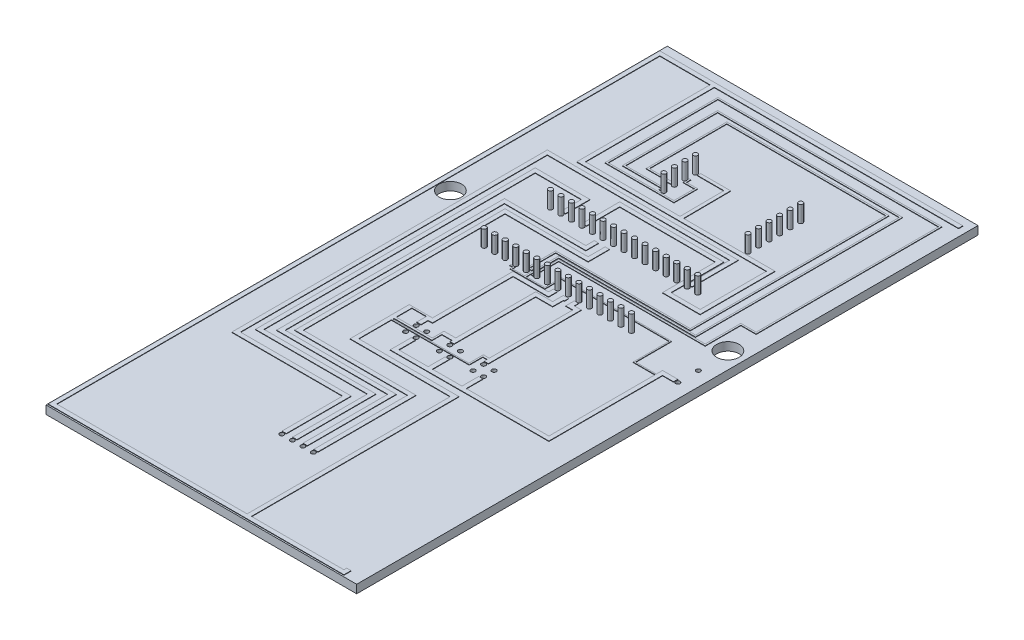
from build123d import *

# Parameters (mm, degrees)
SKETCH5_W           = 75
SKETCH5_H           = 150
BOSS_EXTRUDE1_DEPTH = 2
CUT_EXTRUDE2_START  = -2
SKETCH6_W           = 30
SKETCH6_H           = 30
CUT_EXTRUDE2_DEPTH  = 1.5
SKETCH7_R           = 0.53
BOSS_EXTRUDE2_DEPTH = 1.3
SKETCH8_R           = 0.52
CUT_EXTRUDE3_DEPTH  = 4
CUT_EXTRUDE4_DEPTH  = 4
SKETCH11_R          = 0.525
BOSS_EXTRUDE4_DEPTH = 4
SKETCH13_R          = 0.52
BOSS_EXTRUDE5_DEPTH = 4
CUT_EXTRUDE6_DEPTH  = 1
SKETCH17_R          = 0.52
SKETCH17_R_2        = 2.715
CUT_EXTRUDE8_DEPTH  = 84.94790051
BOSS_EXTRUDE6_DEPTH = 1.1


with BuildPart() as part:
    # Sketch5 → Boss-Extrude1 (new body)
    with BuildSketch(Plane(origin=(0, 0, 0), x_dir=(1, 0, 0), z_dir=(0, 1, 0))):
        Rectangle(SKETCH5_W, SKETCH5_H)
    extrude(amount=BOSS_EXTRUDE1_DEPTH)

    # Sketch6 → Cut-Extrude2 (cut)
    with BuildSketch(Plane(origin=(0, 2, 0), x_dir=(1, 0, 0), z_dir=(0, 1, 0)).offset(CUT_EXTRUDE2_START)):
        with Locations((0, -40)):
            Rectangle(SKETCH6_W, SKETCH6_H)
    extrude(amount=CUT_EXTRUDE2_DEPTH, mode=Mode.SUBTRACT)

    # Sketch7 → Boss-Extrude2 (add)
    with BuildSketch(Plane.XZ.offset(-1.5)):
        with Locations(Location((-2.92, 52.65, 0), (0, 0, 270))):
            Circle(SKETCH7_R)
        with Locations(Location((-0.38, 52.65, 0), (0, 0, 270))):
            Circle(SKETCH7_R)
        with Locations(Location((2.16, 52.65, 0), (0, 0, 270))):
            Circle(SKETCH7_R)
        with Locations(Location((4.7, 52.65, 0), (0, 0, 270))):
            Circle(SKETCH7_R)
    extrude(amount=BOSS_EXTRUDE2_DEPTH)

    # Sketch8 → Cut-Extrude3 (cut)
    with BuildSketch(Plane.XZ.offset(-0.2)):
        with Locations(Location((-2.92, 52.65, 0), (0, 0, 270))):
            Circle(SKETCH8_R)
        with Locations(Location((-0.38, 52.65, 0), (0, 0, 270))):
            Circle(SKETCH8_R)
        with Locations(Location((2.16, 52.65, 0), (0, 0, 270))):
            Circle(SKETCH8_R)
        with Locations(Location((4.7, 52.65, 0), (0, 0, 270))):
            Circle(SKETCH8_R)
    extrude(amount=-CUT_EXTRUDE3_DEPTH, mode=Mode.SUBTRACT)

    # Sketch9 → Cut-Extrude4 (cut)
    with BuildSketch(Plane.XZ):
        with BuildLine():
            ThreePointArc((-8.875, 16.27), (-9.779766594, 16.644766594), (-9.405, 15.74))
            Line((-9.405, 15.74), (-9.405, 16.27))
            Line((-9.405, 16.27), (-8.875, 16.27))
        make_face()
        with BuildLine():
            Line((-9.405, 16.27), (-9.405, 15.74))
            ThreePointArc((-9.405, 15.74), (-9.030233406, 15.895233406), (-8.875, 16.27))
            Line((-8.875, 16.27), (-9.405, 16.27))
        make_face()
        with BuildLine():
            ThreePointArc((-7.395, 16.27), (-7.239766594, 15.895233406), (-6.865, 15.74))
            Line((-6.865, 15.74), (-6.865, 16.27))
            Line((-6.865, 16.27), (-7.395, 16.27))
        make_face()
        with BuildLine():
            Line((-6.865, 16.27), (-6.865, 15.74))
            ThreePointArc((-6.865, 15.74), (-6.490233406, 15.895233406), (-6.335, 16.27))
            ThreePointArc((-6.335, 16.27), (-6.865, 16.8), (-7.395, 16.27))
            Line((-7.395, 16.27), (-6.865, 16.27))
        make_face()
        with BuildLine():
            ThreePointArc((-6.865, 14.26), (-7.239766594, 14.104766594), (-7.395, 13.73))
            Line((-7.395, 13.73), (-6.865, 13.73))
            Line((-6.865, 13.73), (-6.865, 14.26))
        make_face()
        with BuildLine():
            Line((-6.865, 13.73), (-7.395, 13.73))
            ThreePointArc((-7.395, 13.73), (-6.865, 13.2), (-6.335, 13.73))
            ThreePointArc((-6.335, 13.73), (-6.490233406, 14.104766594), (-6.865, 14.26))
            Line((-6.865, 14.26), (-6.865, 13.73))
        make_face()
        with BuildLine():
            Line((-9.405, 14.26), (-9.405, 13.73))
            Line((-9.405, 13.73), (-8.875, 13.73))
            ThreePointArc((-8.875, 13.73), (-9.030233406, 14.104766594), (-9.405, 14.26))
        make_face()
        with BuildLine():
            Line((-8.875, 13.73), (-9.405, 13.73))
            Line((-9.405, 13.73), (-9.405, 14.26))
            ThreePointArc((-9.405, 14.26), (-9.779766594, 13.355233406), (-8.875, 13.73))
        make_face()
        with BuildLine():
            ThreePointArc((-0.74, 16.27), (-1.644766594, 16.644766594), (-1.27, 15.74))
            Line((-1.27, 15.74), (-1.27, 16.27))
            Line((-1.27, 16.27), (-0.74, 16.27))
        make_face()
        with BuildLine():
            Line((-1.27, 16.27), (-1.27, 15.74))
            ThreePointArc((-1.27, 15.74), (-0.895233406, 15.895233406), (-0.74, 16.27))
            Line((-0.74, 16.27), (-1.27, 16.27))
        make_face()
        with BuildLine():
            Line((-1.27, 14.26), (-1.27, 13.73))
            Line((-1.27, 13.73), (-0.74, 13.73))
            ThreePointArc((-0.74, 13.73), (-0.895233406, 14.104766594), (-1.27, 14.26))
        make_face()
        with BuildLine():
            Line((-0.74, 13.73), (-1.27, 13.73))
            Line((-1.27, 13.73), (-1.27, 14.26))
            ThreePointArc((-1.27, 14.26), (-1.644766594, 13.355233406), (-0.74, 13.73))
        make_face()
        with BuildLine():
            ThreePointArc((0.74, 16.27), (0.895233406, 15.895233406), (1.27, 15.74))
            Line((1.27, 15.74), (1.27, 16.27))
            Line((1.27, 16.27), (0.74, 16.27))
        make_face()
        with BuildLine():
            Line((1.27, 16.27), (1.27, 15.74))
            ThreePointArc((1.27, 15.74), (1.644766594, 15.895233406), (1.8, 16.27))
            ThreePointArc((1.8, 16.27), (1.27, 16.8), (0.74, 16.27))
            Line((0.74, 16.27), (1.27, 16.27))
        make_face()
        with BuildLine():
            ThreePointArc((1.27, 14.26), (0.895233406, 14.104766594), (0.74, 13.73))
            Line((0.74, 13.73), (1.27, 13.73))
            Line((1.27, 13.73), (1.27, 14.26))
        make_face()
        with BuildLine():
            Line((1.27, 13.73), (0.74, 13.73))
            ThreePointArc((0.74, 13.73), (1.27, 13.2), (1.8, 13.73))
            ThreePointArc((1.8, 13.73), (1.644766594, 14.104766594), (1.27, 14.26))
            Line((1.27, 14.26), (1.27, 13.73))
        make_face()
        with BuildLine():
            ThreePointArc((7.395, 16.27), (6.490233406, 16.644766594), (6.865, 15.74))
            Line((6.865, 15.74), (6.865, 16.27))
            Line((6.865, 16.27), (7.395, 16.27))
        make_face()
        with BuildLine():
            Line((6.865, 16.27), (6.865, 15.74))
            ThreePointArc((6.865, 15.74), (7.239766594, 15.895233406), (7.395, 16.27))
            Line((7.395, 16.27), (6.865, 16.27))
        make_face()
        with BuildLine():
            ThreePointArc((8.875, 16.27), (9.030233406, 15.895233406), (9.405, 15.74))
            Line((9.405, 15.74), (9.405, 16.27))
            Line((9.405, 16.27), (8.875, 16.27))
        make_face()
        with BuildLine():
            Line((9.405, 16.27), (9.405, 15.74))
            ThreePointArc((9.405, 15.74), (9.779766594, 15.895233406), (9.935, 16.27))
            ThreePointArc((9.935, 16.27), (9.405, 16.8), (8.875, 16.27))
            Line((8.875, 16.27), (9.405, 16.27))
        make_face()
        with BuildLine():
            Line((6.865, 14.26), (6.865, 13.73))
            Line((6.865, 13.73), (7.395, 13.73))
            ThreePointArc((7.395, 13.73), (7.239766594, 14.104766594), (6.865, 14.26))
        make_face()
        with BuildLine():
            Line((7.395, 13.73), (6.865, 13.73))
            Line((6.865, 13.73), (6.865, 14.26))
            ThreePointArc((6.865, 14.26), (6.490233406, 13.355233406), (7.395, 13.73))
        make_face()
        with BuildLine():
            ThreePointArc((9.405, 14.26), (9.030233406, 14.104766594), (8.875, 13.73))
            Line((8.875, 13.73), (9.405, 13.73))
            Line((9.405, 13.73), (9.405, 14.26))
        make_face()
        with BuildLine():
            Line((9.405, 13.73), (8.875, 13.73))
            ThreePointArc((8.875, 13.73), (9.405, 13.2), (9.935, 13.73))
            ThreePointArc((9.935, 13.73), (9.779766594, 14.104766594), (9.405, 14.26))
            Line((9.405, 14.26), (9.405, 13.73))
        make_face()
    extrude(amount=-CUT_EXTRUDE4_DEPTH, mode=Mode.SUBTRACT)

    # Sketch11 → Boss-Extrude4 (add)
    with BuildSketch(Plane(origin=(0, 2, 0), x_dir=(1, 0, 0), z_dir=(0, 1, 0))):
        with Locations(Location((-12.63, 27, 0), (0, 0, 90))):
            Circle(SKETCH11_R)
        with Locations(Location((-17.71, 27, 0), (0, 0, 90))):
            Circle(SKETCH11_R)
        with Locations(Location((-15.17, 27, 0), (0, 0, 90))):
            Circle(SKETCH11_R)
        with Locations(Location((-10.09, 27, 0), (0, 0, 90))):
            Circle(SKETCH11_R)
        with Locations(Location((-7.55, 27, 0), (0, 0, 90))):
            Circle(SKETCH11_R)
        with Locations(Location((-5.01, 27, 0), (0, 0, 90))):
            Circle(SKETCH11_R)
        with Locations(Location((-2.47, 27, 0), (0, 0, 90))):
            Circle(SKETCH11_R)
        with Locations(Location((0.07, 27, 0), (0, 0, 90))):
            Circle(SKETCH11_R)
        with Locations(Location((2.61, 27, 0), (0, 0, 90))):
            Circle(SKETCH11_R)
        with Locations(Location((5.15, 27, 0), (0, 0, 90))):
            Circle(SKETCH11_R)
        with Locations(Location((7.69, 27, 0), (0, 0, 90))):
            Circle(SKETCH11_R)
        with Locations(Location((10.23, 27, 0), (0, 0, 90))):
            Circle(SKETCH11_R)
        with Locations(Location((12.77, 27, 0), (0, 0, 90))):
            Circle(SKETCH11_R)
        with Locations(Location((15.31, 27, 0), (0, 0, 90))):
            Circle(SKETCH11_R)
        with Locations(Location((17.85, 27, 0), (0, 0, 90))):
            Circle(SKETCH11_R)
        with Locations(Location((17.85, 11, 0), (0, 0, 270))):
            Circle(SKETCH11_R)
        with Locations(Location((15.31, 11, 0), (0, 0, 270))):
            Circle(SKETCH11_R)
        with Locations(Location((12.77, 11, 0), (0, 0, 270))):
            Circle(SKETCH11_R)
        with Locations(Location((10.23, 11, 0), (0, 0, 270))):
            Circle(SKETCH11_R)
        with Locations(Location((7.69, 11, 0), (0, 0, 270))):
            Circle(SKETCH11_R)
        with Locations(Location((5.15, 11, 0), (0, 0, 270))):
            Circle(SKETCH11_R)
        with Locations(Location((2.61, 11, 0), (0, 0, 270))):
            Circle(SKETCH11_R)
        with Locations(Location((0.07, 11, 0), (0, 0, 270))):
            Circle(SKETCH11_R)
        with Locations(Location((-2.47, 11, 0), (0, 0, 270))):
            Circle(SKETCH11_R)
        with Locations(Location((-5.01, 11, 0), (0, 0, 270))):
            Circle(SKETCH11_R)
        with Locations(Location((-7.55, 11, 0), (0, 0, 270))):
            Circle(SKETCH11_R)
        with Locations(Location((-12.63, 11, 0), (0, 0, 270))):
            Circle(SKETCH11_R)
        with Locations(Location((-15.17, 11, 0), (0, 0, 270))):
            Circle(SKETCH11_R)
        with Locations(Location((-17.71, 11, 0), (0, 0, 270))):
            Circle(SKETCH11_R)
        with Locations(Location((-10.09, 11, 0), (0, 0, 90))):
            Circle(SKETCH11_R)
    extrude(amount=BOSS_EXTRUDE4_DEPTH)

    # Sketch13 → Boss-Extrude5 (add)
    with BuildSketch(Plane(origin=(0, 2, 0), x_dir=(1, 0, 0), z_dir=(0, 1, 0))):
        with Locations(Location((-7.51, 51.81, 0), (0, 0, 90))):
            Circle(SKETCH13_R)
        with Locations(Location((-7.51, 49.27, 0), (0, 0, 90))):
            Circle(SKETCH13_R)
        with Locations(Location((-7.51, 46.73, 0), (0, 0, 90))):
            Circle(SKETCH13_R)
        with Locations(Location((-7.51, 44.19, 0), (0, 0, 90))):
            Circle(SKETCH13_R)
        with Locations(Location((15.35, 41.65, 0), (0, 0, 90))):
            Circle(SKETCH13_R)
        with Locations(Location((15.35, 44.19, 0), (0, 0, 90))):
            Circle(SKETCH13_R)
        with Locations(Location((15.35, 46.73, 0), (0, 0, 90))):
            Circle(SKETCH13_R)
        with Locations(Location((15.35, 49.27, 0), (0, 0, 90))):
            Circle(SKETCH13_R)
        with Locations(Location((15.35, 51.81, 0), (0, 0, 90))):
            Circle(SKETCH13_R)
        with Locations(Location((15.35, 54.35, 0), (0, 0, 90))):
            Circle(SKETCH13_R)
    extrude(amount=BOSS_EXTRUDE5_DEPTH)

    # Sketch14 → Cut-Extrude6 (cut)
    with BuildSketch(Plane(origin=(0, 2, 0), x_dir=(1, 0, 0), z_dir=(0, 1, 0))):
        Polygon((-3.45, -37.440598334), (-3.45, -52.076712247), (-2.41, -52.076712247), (-2.41, -36.400598334), (-29.156265682, -36.400598334), (-29.156265682, 37.683286397), (14.858811789, 37.683286397), (14.858811789, 27.574015108), (15.898811789, 27.574015108), (15.898811789, 38.723286397), (-30.196265682, 38.723286397), (-30.196265682, -37.440598334), align=None)
        Polygon((-0.892229132, -34.025340097), (-0.892229132, -52.076712247), (0.147770868, -52.076712247), (0.147770868, -32.985340097), (-26.877249445, -32.985340097), (-26.877249445, 32.475975706), (-15.721281921, 32.475975706), (-15.721281921, 27.59841683), (-14.681281921, 27.59841683), (-14.681281921, 33.515975706), (-27.917249445, 33.515975706), (-27.917249445, -34.025340097), align=None)
        Polygon((1.62839372, -31.639264926), (1.62839372, -52.076712247), (2.66839372, -52.076712247), (2.66839372, -30.599264926), (-24.161533394, -30.599264926), (-24.161533394, 22.341620273), (-4.520021819, 22.341620273), (-4.520021819, 25.434559132), (-5.560021819, 25.434559132), (-5.560021819, 23.381620273), (-25.201533394, 23.381620273), (-25.201533394, -31.639264926), align=None)
        Polygon((-1.909073124, 25.434559132), (-2.949073124, 25.434559132), (-2.949073124, 21.318353323), (-23.007588099, 21.318353323), (-23.007588099, -29.451058327), (4.201732223, -29.451058327), (4.201732223, -52.076712247), (5.241732223, -52.076712247), (5.241732223, -28.411058327), (-21.967588099, -28.411058327), (-21.967588099, 20.278353323), (-1.909073124, 20.278353323), align=None)
        Polygon((-8.075, 18.622229391), (-8.075, 11.654544572), (-6.865, 11.654544572), (-6.865, 12.054544572), (-7.675, 12.054544572), (-7.675, 18.222229391), (24.808858324, 18.222229391), (24.808858324, 66.240455779), (-14.386656738, 66.240455779), (-14.386656738, 46.75196079), (-9.764305965, 46.75196079), (-9.764305965, 46.49394445), (-8.075, 46.49394445), (-8.075, 47.15196079), (-13.986656738, 47.15196079), (-13.986656738, 65.840455779), (24.408858324, 65.840455779), (24.408858324, 18.622229391), align=None)
        Polygon((-6.225637853, 17.50559446), (26.797513729, 17.50559446), (26.797513729, 67.507375941), (-17.866025919, 67.507375941), (-17.866025919, 44.49891102), (-8.475, 44.49891102), (-8.475, 43.944201463), (-8.075, 43.944201463), (-8.075, 44.89891102), (-17.466025919, 44.89891102), (-17.466025919, 67.107375941), (26.397513729, 67.107375941), (26.397513729, 17.90559446), (-6.625637853, 17.90559446), (-6.625637853, 9.671574746), (-9.565, 9.671574746), (-9.565, 10.363836114), (-10.615, 10.363836114), (-10.615, 10.063836114), (-9.865, 10.063836114), (-9.865, 9.371574746), (-1.455219558, 9.371574746), (-1.455219558, 13.440012998), (24.508858324, 13.440012998), (24.508858324, 4.7292102), (29.816094455, 4.7292102), (29.816094455, -20.903941699), (9.915, -20.957695577), (9.915, -16.944208048), (8.875, -16.944208048), (8.875, -20.960504671), (1.78, -20.979668631), (1.78, -16.889600252), (0.74, -16.889600252), (0.74, -20.982477724), (-6.335, -21.001587663), (-6.335, -16.926482996), (-7.375, -16.926482996), (-7.375, -22.04440055), (28.776094455, -21.946754586), (28.776094455, -21.957340342), (30.856094455, -21.957340342), (30.856094455, 5.486982431), (33.5, 5.486982431), (33.5, 6.526982431), (29.816094455, 6.526982431), (29.816094455, 5.0292102), (24.808858324, 5.0292102), (24.808858324, 13.740012998), (-1.755219558, 13.740012998), (-1.755219558, 9.671574746), (-6.225637853, 9.671574746), align=None)
        Polygon((-5.531263297, 16.813863546), (29.816094455, 16.813863546), (29.816094455, 25.434559132), (33.5, 25.434559132), (33.5, 70.282853088), (-20.575588412, 70.282853088), (-20.575588412, 43.007607298), (-3.921031823, 43.007607298), (-3.921031823, 48.75), (-6.625637853, 48.75), (-6.625637853, 49.79), (-7.025637853, 49.79), (-7.025637853, 48.35), (-4.321031823, 48.35), (-4.321031823, 43.407607298), (-20.175588412, 43.407607298), (-20.175588412, 69.882853088), (33.1, 69.882853088), (33.1, 25.834559132), (29.416094455, 25.834559132), (29.416094455, 17.213863546), (-5.931263297, 17.213863546), (-5.931263297, 10.662526594), (-5.560021819, 10.662526594), align=None)
        Polygon((-10.609526337, 36.603073063), (-10.609526337, 27.59841683), (-9.569526337, 27.59841683), (-9.569526337, 35.563073063), (13.527607179, 35.563073063), (13.527607179, 22.784024741), (22.64065408, 22.784024741), (22.64065408, 40.848970305), (0.564826327, 40.848970305), (0.477089477, 52.302931457), (-6.723880144, 52.302931457), (-6.723880144, 51.515974719), (-0.364857221, 51.515974719), (-0.283148426, 40.848970305), (-23.121533394, 40.848970305), (-23.121533394, 71.973811823), (35.820633189, 71.973811823), (35.820633189, 73.013811823), (-37.332289969, 73.013811823), (-37.332289969, -74.651519837), (34.078016472, -74.651519837), (34.078016472, -72.927333084), (33.038016472, -72.927333084), (33.038016472, -73.611519837), (10.701259193, -73.611519837), (10.701259193, -23.516878473), (-13.48963499, -23.516878473), (-13.48963499, -15.618806093), (5.299084928, -15.618806093), (5.299084928, -12.351591558), (6.335, -12.351591558), (6.335, -13.079656432), (7.375, -13.079656432), (7.375, 9.370711863), (5.667420021, 9.370711863), (5.667420021, 10.433212653), (4.627420021, 10.433212653), (4.627420021, 8.330711863), (6.335, 8.330711863), (6.335, -11.831591558), (4.917861328, -11.806570089), (4.917861328, -15.330963813), (-13.48963499, -15.330963813), (-13.48963499, -15), (-4.331159684, -15), (-4.331159684, -12.597199133), (-1.936257471, -12.597199133), (-1.936257471, -13.079656432), (-0.896257471, -13.079656432), (-0.896257471, 6.615540099), (3.202534942, 6.615540099), (3.202534942, 9.192761526), (3.431940806, 9.192761526), (3.431940806, 10.232761526), (2.162534942, 10.232761526), (2.162534942, 7.655540099), (-1.936257471, 7.655540099), (-1.936257471, -11.646324462), (-4.76202477, -11.646324462), (-4.76202477, -14.484091059), (-13.48963499, -14.484091059), (-13.48963499, -10.679451836), (-9.976276862, -10.679451836), (-9.976276862, -13.032161971), (-8.936276862, -13.032161971), (-8.936276862, -11.311591558), (-7.896276862, -11.311591558), (-7.896276862, 8.152761526), (0.66, 8.152761526), (0.66, 10.363836114), (-0.38, 10.363836114), (-0.38, 9.192761526), (-8.936276862, 9.192761526), (-8.936276862, -10.271591558), (-14.52963499, -10.271591558), (-14.52963499, -24.556878473), (9.661259193, -24.556878473), (9.661259193, -73.611519837), (-36.292289969, -73.611519837), (-36.292289969, 71.973811823), (-24.161533394, 71.973811823), (-24.161533394, 39.808970305), (21.60065408, 39.808970305), (21.60065408, 23.824024741), (14.567607179, 23.824024741), (14.567607179, 36.603073063), align=None)
    extrude(amount=-CUT_EXTRUDE6_DEPTH, mode=Mode.SUBTRACT)

    # Sketch17 → Cut-Extrude8 (cut, through all)
    with BuildSketch(Plane(origin=(0, 2, 0), x_dir=(1, 0, 0), z_dir=(0, 1, 0))):
        with Locations(Location((34.078016472, 5.970116071, 0), (0, 0, 270))):
            Circle(SKETCH17_R)
        with Locations(Location((34.078016472, 10.917469514, 0), (0, 0, 270))):
            Circle(SKETCH17_R)
        with Locations(Location((33.5, 18.622229391, 0), (0, 0, 270))):
            Circle(SKETCH17_R_2)
        with Locations(Location((-33.5, 18.622229391, 0), (0, 0, 270))):
            Circle(SKETCH17_R_2)
    extrude(amount=-CUT_EXTRUDE8_DEPTH, mode=Mode.SUBTRACT)

    # Sketch19 → Boss-Extrude6 (add)
    with BuildSketch(Plane(origin=(0, 1, 0), x_dir=(1, 0, 0), z_dir=(0, 1, 0))):
        Polygon((-9.565, 9.671574746), (-9.565, 10.363836114), (-10.615, 10.363836114), (-10.615, 10.063836114), (-9.865, 10.063836114), (-9.865, 9.371574746), (-1.455219558, 9.371574746), (-1.455219558, 13.440012998), (24.508858324, 13.440012998), (24.508858324, 4.7292102), (29.816094455, 4.7292102), (29.816094455, -20.903941699), (9.915, -20.957695577), (9.915, -16.944208048), (8.875, -16.944208048), (8.875, -20.960504671), (1.78, -20.979668631), (1.78, -16.889600252), (0.74, -16.889600252), (0.74, -20.982477724), (-6.335, -21.001587663), (-6.335, -16.926482996), (-7.375, -16.926482996), (-7.375, -22.04440055), (28.776094455, -21.946754586), (28.776094455, -21.957340342), (30.856094455, -21.957340342), (30.856094455, 5.486982431), (33.5, 5.486982431), (33.5, 6.526982431), (29.816094455, 6.526982431), (29.816094455, 5.0292102), (24.808858324, 5.0292102), (24.808858324, 13.740012998), (-1.755219558, 13.740012998), (-1.755219558, 9.671574746), (-6.225637853, 9.671574746), (-6.225637853, 17.50559446), (26.797513729, 17.50559446), (26.797513729, 67.507375941), (-17.866025919, 67.507375941), (-17.866025919, 44.49891102), (-8.475, 44.49891102), (-8.475, 43.944201463), (-8.075, 43.944201463), (-8.075, 44.89891102), (-17.466025919, 44.89891102), (-17.466025919, 67.107375941), (26.397513729, 67.107375941), (26.397513729, 17.90559446), (-6.625637853, 17.90559446), (-6.625637853, 9.671574746), align=None)
        Polygon((-7.675, 12.054544572), (-7.675, 18.222229391), (24.808858324, 18.222229391), (24.808858324, 66.240455779), (-14.386656738, 66.240455779), (-14.386656738, 46.75196079), (-9.764305965, 46.75196079), (-9.764305965, 46.49394445), (-8.075, 46.49394445), (-8.075, 47.15196079), (-13.986656738, 47.15196079), (-13.986656738, 65.840455779), (24.408858324, 65.840455779), (24.408858324, 18.622229391), (-8.075, 18.622229391), (-8.075, 11.654544572), (-6.865, 11.654544572), (-6.865, 12.054544572), align=None)
        Polygon((-5.931263297, 17.213863546), (-5.931263297, 10.662526594), (-5.560021819, 10.662526594), (-5.531263297, 16.813863546), (29.816094455, 16.813863546), (29.816094455, 25.434559132), (33.5, 25.434559132), (33.5, 70.282853088), (-20.575588412, 70.282853088), (-20.575588412, 43.007607298), (-3.921031823, 43.007607298), (-3.921031823, 48.75), (-6.625637853, 48.75), (-6.625637853, 49.79), (-7.025637853, 49.79), (-7.025637853, 48.35), (-4.321031823, 48.35), (-4.321031823, 43.407607298), (-20.175588412, 43.407607298), (-20.175588412, 69.882853088), (33.1, 69.882853088), (33.1, 25.834559132), (29.416094455, 25.834559132), (29.416094455, 17.213863546), align=None)
        Polygon((-7.896276862, 8.152761526), (0.66, 8.152761526), (0.66, 10.363836114), (-0.38, 10.363836114), (-0.38, 9.192761526), (-8.936276862, 9.192761526), (-8.936276862, -10.271591558), (-14.52963499, -10.271591558), (-14.52963499, -24.556878473), (9.661259193, -24.556878473), (9.661259193, -73.611519837), (-36.292289969, -73.611519837), (-36.292289969, 71.973811823), (-24.161533394, 71.973811823), (-24.161533394, 39.808970305), (21.60065408, 39.808970305), (21.60065408, 23.824024741), (14.567607179, 23.824024741), (14.567607179, 36.603073063), (-10.609526337, 36.603073063), (-10.609526337, 27.59841683), (-9.569526337, 27.59841683), (-9.569526337, 35.563073063), (13.527607179, 35.563073063), (13.527607179, 22.784024741), (22.64065408, 22.784024741), (22.64065408, 40.848970305), (0.564826327, 40.848970305), (0.477089477, 52.302931457), (-6.723880144, 52.302931457), (-6.723880144, 51.515974719), (-0.364857221, 51.515974719), (-0.283148426, 40.848970305), (-23.121533394, 40.848970305), (-23.121533394, 71.973811823), (35.820633189, 71.973811823), (35.820633189, 73.013811823), (-37.332289969, 73.013811823), (-37.332289969, -74.651519837), (34.078016472, -74.651519837), (34.078016472, -72.927333084), (33.038016472, -72.927333084), (33.038016472, -73.611519837), (10.701259193, -73.611519837), (10.701259193, -23.516878473), (-13.48963499, -23.516878473), (-13.48963499, -15.618806093), (5.299084928, -15.618806093), (5.299084928, -12.351591558), (6.335, -12.351591558), (6.335, -13.079656432), (7.375, -13.079656432), (7.375, 9.370711863), (5.667420021, 9.370711863), (5.667420021, 10.433212653), (4.627420021, 10.433212653), (4.627420021, 8.330711863), (6.335, 8.330711863), (6.335, -11.831591558), (4.917861328, -11.806570089), (4.917861328, -15.330963813), (-13.48963499, -15.330963813), (-13.48963499, -15), (-4.331159684, -15), (-4.331159684, -12.597199133), (-1.936257471, -12.597199133), (-1.936257471, -13.079656432), (-0.896257471, -13.079656432), (-0.896257471, 6.615540099), (3.202534942, 6.615540099), (3.202534942, 9.192761526), (3.431940806, 9.192761526), (3.431940806, 10.232761526), (2.162534942, 10.232761526), (2.162534942, 7.655540099), (-1.936257471, 7.655540099), (-1.936257471, -11.646324462), (-4.76202477, -11.646324462), (-4.76202477, -14.484091059), (-13.48963499, -14.484091059), (-13.48963499, -10.679451836), (-9.976276862, -10.679451836), (-9.976276862, -13.032161971), (-8.936276862, -13.032161971), (-8.936276862, -11.311591558), (-7.896276862, -11.311591558), align=None)
        Polygon((-2.949073124, 21.318353323), (-23.007588099, 21.318353323), (-23.007588099, -29.451058327), (4.201732223, -29.451058327), (4.201732223, -52.076712247), (5.241732223, -52.076712247), (5.241732223, -28.411058327), (-21.967588099, -28.411058327), (-21.967588099, 20.278353323), (-1.909073124, 20.278353323), (-1.909073124, 25.434559132), (-2.949073124, 25.434559132), align=None)
        Polygon((-5.560021819, 23.381620273), (-25.201533394, 23.381620273), (-25.201533394, -31.639264926), (1.62839372, -31.639264926), (1.62839372, -52.076712247), (2.66839372, -52.076712247), (2.66839372, -30.599264926), (-24.161533394, -30.599264926), (-24.161533394, 22.341620273), (-4.520021819, 22.341620273), (-4.520021819, 25.434559132), (-5.560021819, 25.434559132), align=None)
        Polygon((-15.721281921, 32.475975706), (-15.721281921, 27.59841683), (-14.681281921, 27.59841683), (-14.681281921, 33.515975706), (-27.917249445, 33.515975706), (-27.917249445, -34.025340097), (-0.892229132, -34.025340097), (-0.892229132, -52.076712247), (0.147770868, -52.076712247), (0.147770868, -32.985340097), (-26.877249445, -32.985340097), (-26.877249445, 32.475975706), align=None)
        Polygon((15.898811789, 38.723286397), (-30.196265682, 38.723286397), (-30.196265682, -37.440598334), (-3.45, -37.440598334), (-3.45, -52.076712247), (-2.41, -52.076712247), (-2.41, -36.400598334), (-29.156265682, -36.400598334), (-29.156265682, 37.683286397), (14.858811789, 37.683286397), (14.858811789, 27.574015108), (15.898811789, 27.574015108), align=None)
    extrude(amount=BOSS_EXTRUDE6_DEPTH)


solid = part.part
